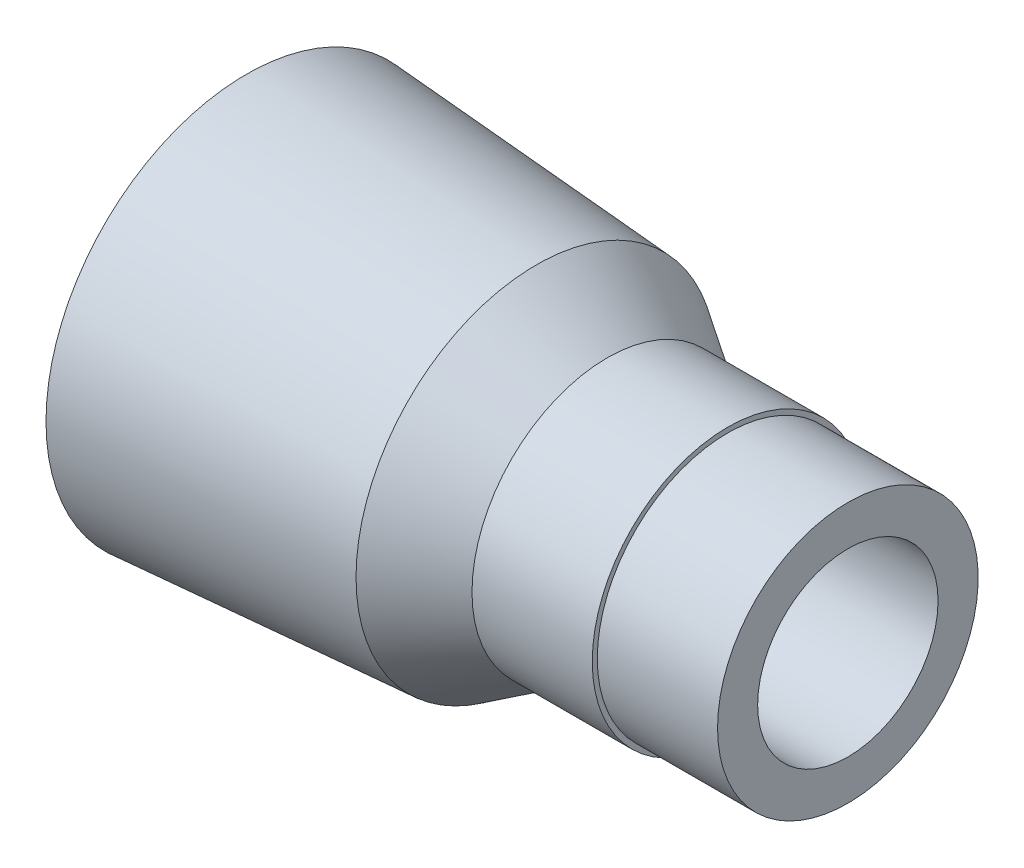
from build123d import *

# Parameters (mm, degrees)
SKETCH7_R           = 9.9
CUT_EXTRUDE4_DEPTH  = 2
CUT_EXTRUDE4_DRAFT  = -2
BOSS_EXTRUDE2_START = 2
BOSS_EXTRUDE2_DEPTH = 2
THREAD1_PITCH       = 2
CIRPATTERN1_COUNT   = 8


with BuildPart() as part:
    # Sketch1 → Revolve2 (revolve)
    with BuildSketch(Plane(origin=(0, 0, 0), x_dir=(1, 0, 0), z_dir=(0, 1, 0))):
        Polygon((15, -7.5), (0, -7.5), (0, -10), (14.465476141, -9), (18, -6.75), (24, -6.75), (24, -6.5), (30, -6.5), (30, -4.5), (19, -4.5), (19, -3), (15, -3), align=None)
    revolve(axis=Axis((0, 0, 0), (1, 0, 0)))


with BuildPart() as cut_extrude4_tool:
    # Sketch7 → Cut-Extrude4 (with draft: the straight prism first)
    with BuildSketch(Plane.ZY):
        Circle(SKETCH7_R)
    extrude(amount=-CUT_EXTRUDE4_DEPTH)
    # Cut-Extrude4: the draft: its side faces are tilted about the plane it starts from
    cut_extrude4_sides = [cut_extrude4_tool.faces().sort_by_distance(p)[0] for p in [
        (1, 0, -9.9),
    ]]
    draft(cut_extrude4_sides, Plane.ZY, CUT_EXTRUDE4_DRAFT)


with BuildPart() as part_1:
    add(part.part)

    # Cut-Extrude4: cut by cut_extrude4_tool
    add(cut_extrude4_tool.part, mode=Mode.SUBTRACT)

    # Sketch9 → Boss-Extrude2 (add)
    with BuildSketch(Plane.ZY.offset(-2).offset(BOSS_EXTRUDE2_START)):
        with BuildLine():
            Line((-6.542585961, -3.666683644), (-8.575287565, -4.8058775))
            ThreePointArc((-8.575287565, -4.8058775), (-9.241617123, -3.350302721), (-9.66285785, -1.8058775))
            Line((-9.66285785, -1.8058775), (-7.344504429, -1.519294142))
            ThreePointArc((-7.344504429, -1.519294142), (-7.026068623, -2.62380634), (-6.542585961, -3.666683644))
        make_face()
    boss_extrude2 = extrude(amount=-BOSS_EXTRUDE2_DEPTH)

    # Thread1: the profile of Thread Profile1 profile screwed along a right-hand helix of 6.5 turns, 10 arcs to a turn; built about Z, then put on its axis
    thread1_z = Axis((0, 0, 0), (0, 0, 1))
    thread1_corners = [(7.4997, 0, -0.000173205), (7.4997, 0, 0.218923204), (7.635316469, 0, 0.140625), (7.635316469, 0, 0.078125)]
    with BuildLine(mode=Mode.PRIVATE) as thread1_profile:
        Line(thread1_corners[0], thread1_corners[1])
        Line(thread1_corners[1], thread1_corners[2])
        Line(thread1_corners[2], thread1_corners[3])
        Line(thread1_corners[3], thread1_corners[0])
    thread1_cap = Face(thread1_profile.wire())
    thread1_turn_angles = [0, 18, 36, 54, 72, 90, 108, 126, 144, 162, 180, 198, 216, 234, 252, 270, 288, 306, 324, 342, 360]
    thread1_turn_weights = [1, 0.9510565162951535, 1, 0.9510565162951535, 1, 0.9510565162951535, 1, 0.9510565162951535, 1, 0.9510565162951535, 1, 0.9510565162951535, 1, 0.9510565162951535, 1, 0.9510565162951535, 1, 0.9510565162951535, 1, 0.9510565162951535, 1]
    thread1_turn_rails = [Edge.make_bspline([Vector(p[0], p[1], 0).rotate(thread1_z, thread1_turn_angles[k]) / thread1_turn_weights[k] + Vector(0, 0, p[2] + THREAD1_PITCH * thread1_turn_angles[k] / 360) for k in range(21)], [0, 0, 0, 1, 1, 2, 2, 3, 3, 4, 4, 5, 5, 6, 6, 7, 7, 8, 8, 9, 9, 10, 10, 10], 2, thread1_turn_weights) for p in thread1_corners]
    thread1_turn_sides = [Face.make_surface_from_curves(thread1_turn_rails[p[0]], thread1_turn_rails[p[1]]) for p in [(0, 1), (1, 2), (2, 3), (3, 0)]]
    thread1_last_angles = [2160, 2178, 2196, 2214, 2232, 2250, 2268, 2286, 2304, 2322, 2340]
    thread1_last_weights = [1, 0.9510565162951535, 1, 0.9510565162951535, 1, 0.9510565162951535, 1, 0.9510565162951535, 1, 0.9510565162951535, 1]
    thread1_last_rails = [Edge.make_bspline([Vector(p[0], p[1], 0).rotate(thread1_z, thread1_last_angles[k]) / thread1_last_weights[k] + Vector(0, 0, p[2] + THREAD1_PITCH * thread1_last_angles[k] / 360) for k in range(11)], [0, 0, 0, 1, 1, 2, 2, 3, 3, 4, 4, 5, 5, 5], 2, thread1_last_weights) for p in thread1_corners]
    thread1_last_sides = [Face.make_surface_from_curves(thread1_last_rails[p[0]], thread1_last_rails[p[1]]) for p in [(0, 1), (1, 2), (2, 3), (3, 0)]]
    thread1 = Plane(origin=(15, 0, 0), x_dir=(0, 0, 1), z_dir=(-1, 0, 0)) * Solid(Shell([*[p.moved(Location((0, 0, THREAD1_PITCH * i))) for i in range(6) for p in thread1_turn_sides], *thread1_last_sides, thread1_cap, thread1_cap.rotate(thread1_z, 2340).moved(Location((0, 0, THREAD1_PITCH * 2340 / 360)))]))
    add(thread1, mode=Mode.SUBTRACT)

    # CirPattern1: Boss-Extrude2 ×8 about axis
    cirpattern1_axis = Axis((0, 0, 0), (1, 0, 0))
    for i in range(1, CIRPATTERN1_COUNT):
        add(boss_extrude2.rotate(cirpattern1_axis, i * 360 / CIRPATTERN1_COUNT))


solid = part_1.part
